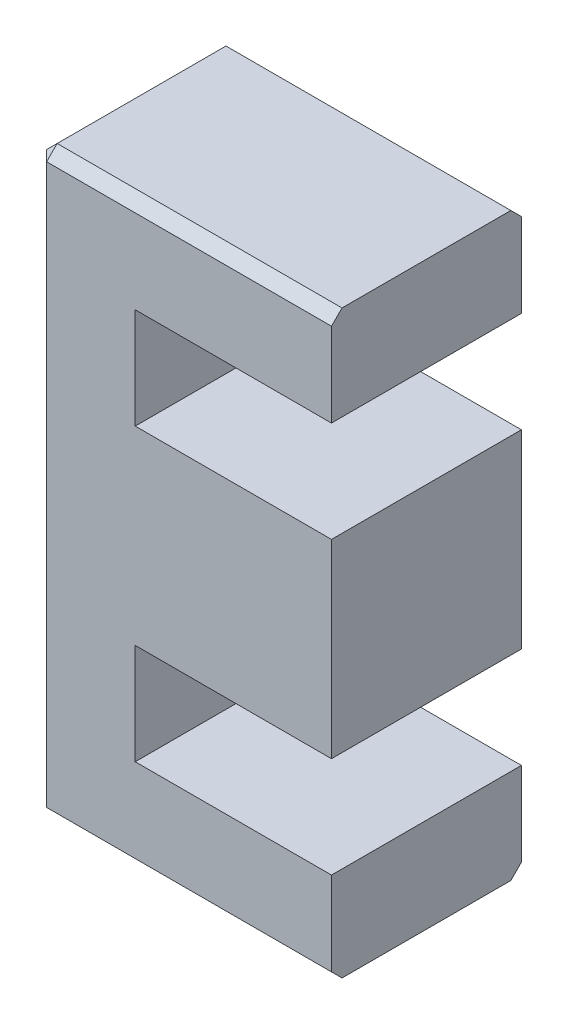
from build123d import *

# Parameters (mm, degrees)
BOSS_EXTRUDE1_DEPTH = 18
CHAMFER1_SIZE       = 2


with BuildPart() as part:
    # Sketch1 → Boss-Extrude1 (new, symmetric)
    with BuildSketch(Plane.XY):
        Polygon((28, 55), (-28, 55), (-28, -55), (28, -55), (28, -37.1), (-9.2, -37.1), (-9.2, -18), (28, -18), (28, 18), (-9.2, 18), (-9.2, 37.1), (28, 37.1), align=None)
    extrude(amount=BOSS_EXTRUDE1_DEPTH, both=True)

    # Chamfer1
    chamfer1_edges = [part.edges().sort_by_distance(p)[0] for p in [
        (0, 55, 18),
        (0, -55, -18),
        (0, -55, 18),
        (-28, -55, 0),
        (-28, 0, 18),
        (-28, 0, -18),
        (0, 55, -18),
        (-28, 55, 0),
    ]]
    chamfer(chamfer1_edges, length=CHAMFER1_SIZE)


solid = part.part
